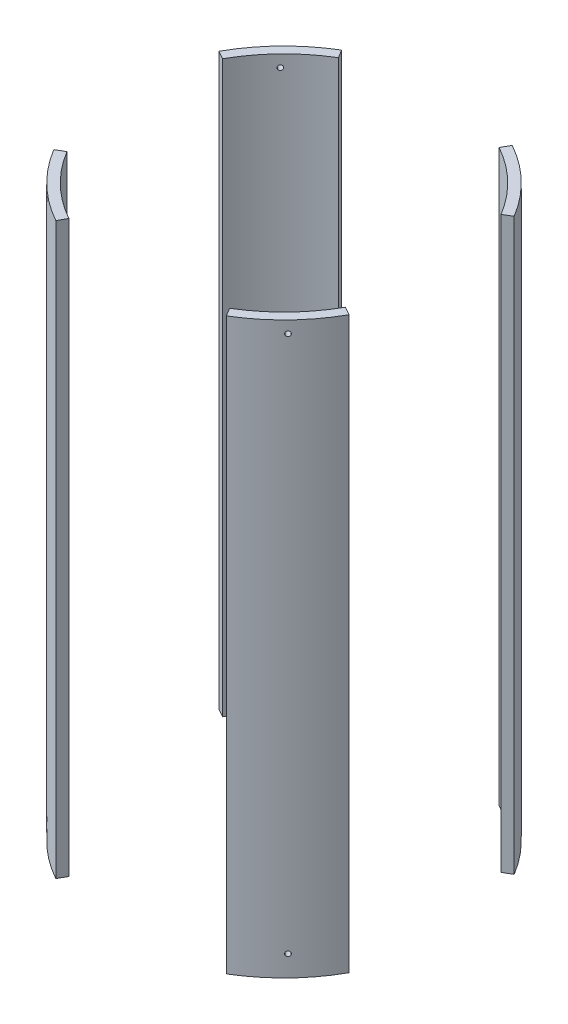
from build123d import *

# Parameters (mm, degrees)
SKETCH2_R               = 88.9
SKETCH2_R_2             = 83.82
BOSS_EXTRUDE1_DEPTH     = 150.97633
CUT_EXTRUDE1_DEPTH      = 197.469519825
CUT_EXTRUDE1_DEPTH_BACK = 197.469519825
SKETCH5_R               = 1.27
BOLT_HOLES_DEPTH        = 244.3449189
BOLT_PATTERN_COUNT      = 4


with BuildPart() as part:
    # Sketch2 → Boss-Extrude1 (new, symmetric)
    with BuildSketch(Plane(origin=(0, 0, 0), x_dir=(1, 0, 0), z_dir=(0, 1, 0))):
        Circle(SKETCH2_R)
        Circle(SKETCH2_R_2, mode=Mode.SUBTRACT)
    extrude(amount=BOSS_EXTRUDE1_DEPTH, both=True)

    # Sketch3 → Cut-Extrude1 (cut, two sides: drawn at the far end of the back side and taken through both)
    with BuildSketch(Plane(origin=(0, 0, 0), x_dir=(1, 0, 0), z_dir=(0, 1, 0)).offset(-CUT_EXTRUDE1_DEPTH_BACK)):
        Polygon((-58.116685864, 96.974944394), (0, 0), (53.900027233, 96.974944394), align=None)
        Polygon((70.991745134, -118.45858783), (0, 0), (-65.840936026, -118.45858783), align=None)
        Polygon((169.661755759, 101.677593364), (0, 0), (169.661755759, -94.300371224), align=None)
        Polygon((-123.741299607, -74.157652604), (0, 0), (-123.741299607, 68.777140945), align=None)
    extrude(amount=CUT_EXTRUDE1_DEPTH + CUT_EXTRUDE1_DEPTH_BACK, mode=Mode.SUBTRACT)


with BuildPart() as cut_extrude1_piece_1:
    # of the separate pieces the step leaves, piece 1, a body of its own (cut_extrude1_pieces)
    add(part.part.solids().sort_by_distance((-45.699187432, -150.97633, -76.254798328))[0])


with BuildPart() as cut_extrude1_piece_2:
    # of the separate pieces the step leaves, piece 2, a body of its own (cut_extrude1_pieces)
    add(part.part.solids().sort_by_distance((45.699187432, -150.97633, 76.254798328))[0])


with BuildPart() as cut_extrude1_piece_3:
    # of the separate pieces the step leaves, piece 3, a body of its own (cut_extrude1_pieces)
    add(part.part.solids().sort_by_distance((76.254798328, -150.97633, -45.699187432))[0])


with BuildPart() as cut_extrude1_piece_4:
    # of the separate pieces the step leaves, piece 4, a body of its own (cut_extrude1_pieces)
    add(part.part.solids().sort_by_distance((-76.254798328, -150.97633, 45.699187432))[0])

    # Sketch5 → Bolt holes (cut, through all)
    with BuildSketch(Plane(origin=(-56.309218645, 0, 58.175814955), x_dir=(-0.7185401515036821, 0, -0.6954854784084752), z_dir=(0.6954854784084752, 0, -0.7185401515036821))):
        with Locations((-0.02278764, 144.62633)):
            Circle(SKETCH5_R)
        with Locations((-0.02278764, -139.86383)):
            Circle(SKETCH5_R)
    bolt_holes = extrude(amount=-BOLT_HOLES_DEPTH, mode=Mode.SUBTRACT)


with BuildPart() as bolt_pattern_tool:
    # Bolt pattern: Bolt holes ×4 about axis
    bolt_pattern_axis = Axis((0, 150.97633, 0), (0, 1, 0))
    for i in range(1, BOLT_PATTERN_COUNT):
        add(bolt_holes.rotate(bolt_pattern_axis, i * 360 / BOLT_PATTERN_COUNT))


with BuildPart() as cut_extrude1_piece_1_1:
    add(cut_extrude1_piece_1.part)

    # Bolt pattern: cut by bolt_pattern_tool
    add(bolt_pattern_tool.part, mode=Mode.SUBTRACT)


with BuildPart() as cut_extrude1_piece_2_1:
    add(cut_extrude1_piece_2.part)

    # Bolt pattern: cut by bolt_pattern_tool
    add(bolt_pattern_tool.part, mode=Mode.SUBTRACT)


with BuildPart() as cut_extrude1_piece_3_1:
    add(cut_extrude1_piece_3.part)

    # Bolt pattern: cut by bolt_pattern_tool
    add(bolt_pattern_tool.part, mode=Mode.SUBTRACT)


solid = Compound([cut_extrude1_piece_4.part, cut_extrude1_piece_1_1.part, cut_extrude1_piece_2_1.part, cut_extrude1_piece_3_1.part])
